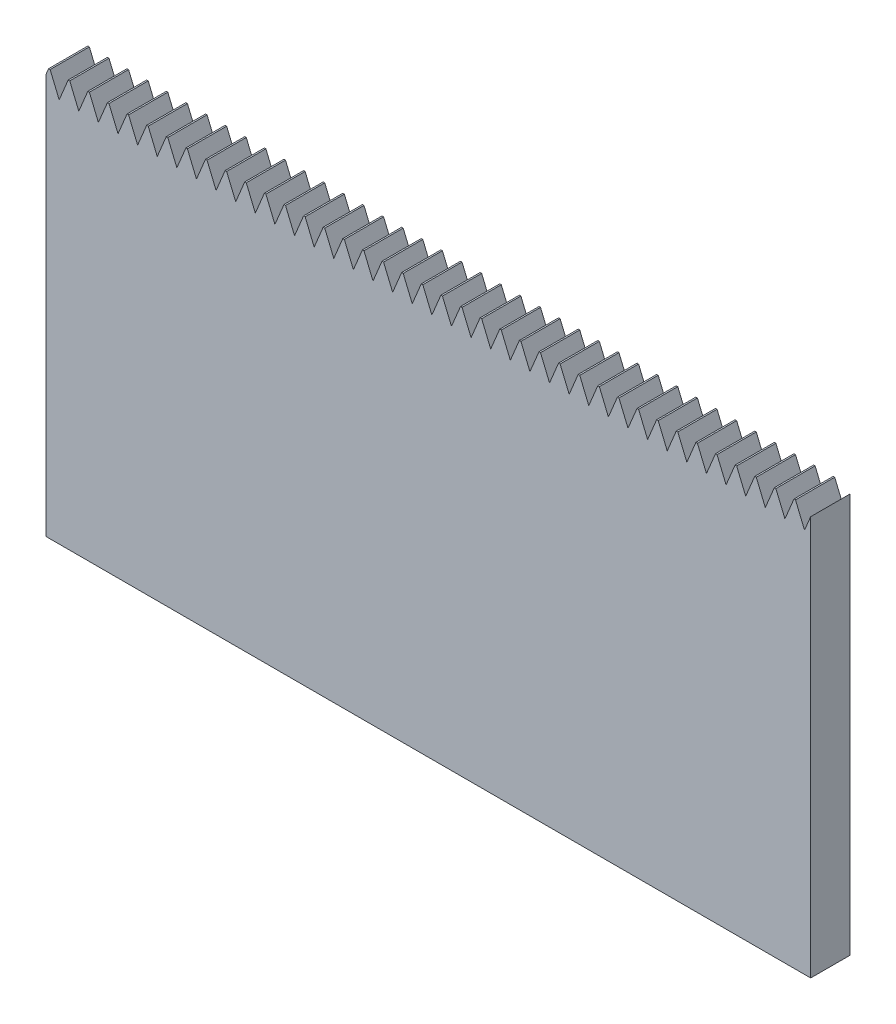
from build123d import *

# Parameters (mm, degrees)
SKETCH9_W           = 97.4508292
SKETCH9_H           = 51.807344848
BOSS_EXTRUDE3_DEPTH = 5
CUT_EXTRUDE9_DEPTH  = 111.479251862
LPATTERN1_COUNT     = 23
LPATTERN1_PITCH     = 2.5
LPATTERN2_DEPTH     = 5


# Read off the part's stored shape, not the designer's step: LPattern2
with BuildPart() as part:
    # Sketch9 → Boss-Extrude3 (new body)
    with BuildSketch(Plane.XY):
        with Locations((48.7254146, 25.903672424)):
            Rectangle(SKETCH9_W, SKETCH9_H)
    extrude(amount=BOSS_EXTRUDE3_DEPTH)

    # Sketch13 → Cut-Extrude9 (cut, symmetric)
    with BuildSketch(Plane.XY.offset(5)):
        Polygon((-22.504808693, 203.169515117), (40.514829285, 51.807344848), (41.667928087, 49.037802801), (42.821026889, 51.807344848), (105.840664868, 203.169515117), (105.840664868, 531.084024461), (-22.504808693, 531.084024461), align=None)
    cut_extrude9 = extrude(amount=CUT_EXTRUDE9_DEPTH, both=True, mode=Mode.SUBTRACT)

    # LPattern1: Cut-Extrude9 ×23
    with Locations(*[(i * LPATTERN1_PITCH, 0, 0) for i in range(1, LPATTERN1_COUNT)]):
        add(cut_extrude9, mode=Mode.SUBTRACT)

    # LPattern2 outline → LPattern2 (cut)
    with BuildSketch(Plane.XY):
        Polygon((0, 51.036294296), (0.321026889, 51.807344848), (0, 51.807344848), align=None)
        Polygon((1.667928087, 49.037802801), (2.821026889, 51.807344848), (0.514829285, 51.807344848), align=None)
        Polygon((4.167928087, 49.037802801), (5.321026889, 51.807344848), (3.014829285, 51.807344848), align=None)
        Polygon((6.667928087, 49.037802801), (7.821026889, 51.807344848), (5.514829285, 51.807344848), align=None)
        Polygon((9.167928087, 49.037802801), (10.321026889, 51.807344848), (8.014829285, 51.807344848), align=None)
        Polygon((11.667928087, 49.037802801), (12.821026889, 51.807344848), (10.514829285, 51.807344848), align=None)
        Polygon((14.167928087, 49.037802801), (15.321026889, 51.807344848), (13.014829285, 51.807344848), align=None)
        Polygon((16.667928087, 49.037802801), (17.821026889, 51.807344848), (15.514829285, 51.807344848), align=None)
        Polygon((19.167928087, 49.037802801), (20.321026889, 51.807344848), (18.014829285, 51.807344848), align=None)
        Polygon((21.667928087, 49.037802801), (22.821026889, 51.807344848), (20.514829285, 51.807344848), align=None)
        Polygon((24.167928087, 49.037802801), (25.321026889, 51.807344848), (23.014829285, 51.807344848), align=None)
        Polygon((26.667928087, 49.037802801), (27.821026889, 51.807344848), (25.514829285, 51.807344848), align=None)
        Polygon((29.167928087, 49.037802801), (30.321026889, 51.807344848), (28.014829285, 51.807344848), align=None)
        Polygon((31.667928087, 49.037802801), (32.821026889, 51.807344848), (30.514829285, 51.807344848), align=None)
        Polygon((34.167928087, 49.037802801), (35.321026889, 51.807344848), (33.014829285, 51.807344848), align=None)
        Polygon((36.667928087, 49.037802801), (37.821026889, 51.807344848), (35.514829285, 51.807344848), align=None)
        Polygon((38.014829285, 51.807344848), (39.167928087, 49.037802801), (40.321026889, 51.807344848), align=None)
    extrude(amount=LPATTERN2_DEPTH, mode=Mode.SUBTRACT)


solid = part.part
